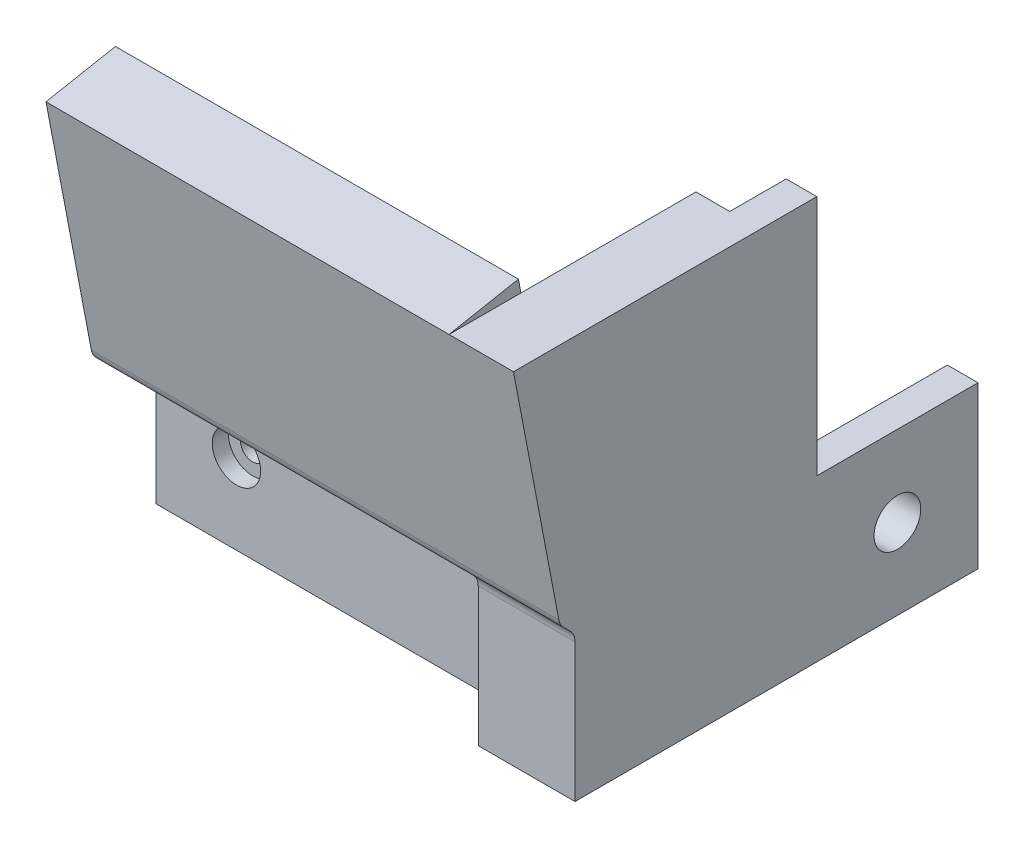
from build123d import *

# Parameters (mm, degrees)
EXTRUDE_1_DEPTH      = 50
SKETCH_2_W           = 50
SKETCH_2_H           = 10
EXTRUDE_2_DEPTH      = 10
SKETCH_3_W           = 10
SKETCH_3_H           = 20
EXTRUDE_3_DEPTH      = 20
SKETCH_4_W           = 20
SKETCH_4_H           = 10
EXTRUDE_4_DEPTH      = 30
CUT_EXTRUDE_1_DEPTH  = 50
CHAMFER_1_SIZE       = 2
SKETCH_9_R           = 1.5
CUT_EXTRUDE_2_DEPTH  = 66.715656955
CUT_EXTRUDE_4_DEPTH  = 6
SKETCH_13_W          = 4
SKETCH_13_H          = 6
EXTRUDE_12_DEPTH     = 18.003980276
FILLET_2_R           = 2
SKETCH_15_W          = 20
SKETCH_15_H          = 50
SKETCH_15_R          = 1.5
EXTRUDE_14_DEPTH     = 4
CUT_EXTRUDE_5_DEPTH  = 4
SKETCH_17_W          = 16
SKETCH_17_H          = 50
CUT_EXTRUDE_6_DEPTH  = 4
EXTRUDE_15_DEPTH     = 10
SKETCH_20_W          = 4
SKETCH_20_H          = 50
EXTRUDE_16_DEPTH     = 20
SKETCH_23_W          = 24
SKETCH_23_H          = 22
CUT_EXTRUDE_9_DEPTH  = 4
EXTRUDE_17_REACH     = 74.184
SKETCH_25_W          = 4
SKETCH_25_H          = 12.288957455
EXTRUDE_18_DEPTH     = 22
CUT_EXTRUDE_10_DEPTH = 4
CUT_EXTRUDE_START    = -4
CUT_EXTRUDE_11_DEPTH = 4
CUT_EXTRUDE_14_DEPTH = 10
EXTRUDE_19_DEPTH     = 4
SKETCH_35_W          = 8
SKETCH_35_H          = 20
EXTRUDE_20_DEPTH     = 22
SKETCH_36_W          = 8
SKETCH_36_H          = 20
EXTRUDE_21_DEPTH     = 20
CUT_EXTRUDE_17_DEPTH = 4.2
SKETCH_38_R          = 1.5
CUT_EXTRUDE_18_DEPTH = 10
SKETCH_39_R          = 2.9
CUT_EXTRUDE_19_DEPTH = 6
SKETCH_40_R          = 3
CUT_EXTRUDE_20_DEPTH = 2
SKETCH_41_W          = 50
SKETCH_41_H          = 16.011247617
EXTRUDE_22_DEPTH     = 1


with BuildPart() as part:
    # 草图1 → 凸台-拉伸1 (new body)
    with BuildSketch(Plane(origin=(0, 0, 0), x_dir=(0, 0, -1), z_dir=(1, 0, 0))):
        Polygon((0, 0), (-10, 0), (-17.629858184, 40), (-10, 41.455368398), (-4, 10), (0, 10), align=None)
    extrude(amount=EXTRUDE_1_DEPTH)

    # 草图2 → 凸台-拉伸2 (add)
    with BuildSketch(Plane.XZ):
        with Locations((25, 5)):
            Rectangle(SKETCH_2_W, SKETCH_2_H)
    extrude(amount=EXTRUDE_2_DEPTH)

    # 草图3 → 凸台-拉伸3 (add)
    with BuildSketch(Plane.ZY):
        with Locations((5, 0)):
            Rectangle(SKETCH_3_W, SKETCH_3_H)
    extrude(amount=EXTRUDE_3_DEPTH)

    # 草图4 → 凸台-拉伸4 (add)
    with BuildSketch(Plane(origin=(0, 10, 0), x_dir=(1, 0, 0), z_dir=(0, 1, 0))):
        with Locations((-10, -5)):
            Rectangle(SKETCH_4_W, SKETCH_4_H)
    extrude(amount=EXTRUDE_4_DEPTH)

    # 草图5 → 切除-拉伸1 (cut)
    with BuildSketch(Plane(origin=(50, 0, 0), x_dir=(0, 0, -1), z_dir=(1, 0, 0))):
        Polygon((-10, 10.003980276), (-11.908223769, 10.003980276), (-10, 0), align=None)
    extrude(amount=-CUT_EXTRUDE_1_DEPTH, mode=Mode.SUBTRACT)

    # 倒角1
    # the kernel refuses this chamfer: 2 mm, written as the material it adds along each edge
    with BuildSketch(Plane(origin=(50, 10.003980276, 10), x_dir=(0, 0.027495876610586487, 0.9996219169112968), z_dir=(-1, 0, 0))) as chamfer_1_piece_1_section:
        Polygon((CHAMFER_1_SIZE * 0.999621916911, -CHAMFER_1_SIZE * 0.0274958766106), (-CHAMFER_1_SIZE * 0.0274958766106, -CHAMFER_1_SIZE * 0.999621916911), (0, 0), align=None)
    chamfer_1_piece_1 = extrude(amount=50, mode=Mode.PRIVATE)
    chamfer_1_piece_1 = split(chamfer_1_piece_1, bisect_by=Plane(origin=(25, 9.131023425, 11.741710345), z_dir=(0, 0.18736828457892524, -0.9822897362458548)), keep=Keep.TOP, mode=Mode.PRIVATE)
    add(chamfer_1_piece_1)

    # 草图9 → 切除-拉伸2 (cut, through all)
    with BuildSketch(Plane.XY.offset(10)):
        with Locations((-10, 20)):
            Circle(SKETCH_9_R)
        with Locations((10, 0)):
            Circle(SKETCH_9_R)
    extrude(amount=-CUT_EXTRUDE_2_DEPTH, mode=Mode.SUBTRACT)

    # 草图12 → 切除-拉伸4 (cut)
    with BuildSketch(Plane.XY.offset(10)):
        Polygon((50, -10), (50, 8.003980276), (0, 8.003980276), (0, 40), (-20, 40), (-20, -10), align=None)
    extrude(amount=-CUT_EXTRUDE_4_DEPTH, mode=Mode.SUBTRACT)

    # 草图13 → 凸台-拉伸12 (add)
    with BuildSketch(Plane.XZ.offset(-8.003980276)):
        with Locations((2, 7)):
            Rectangle(SKETCH_13_W, SKETCH_13_H)
        with Locations((48, 7)):
            Rectangle(SKETCH_13_W, SKETCH_13_H)
    extrude(amount=EXTRUDE_12_DEPTH)

    # 圆角2
    fillet_2_edges = [part.edges().sort_by_distance(p)[0] for p in [
        (2, 8.003980276, 10),
        (48, 8.003980276, 10),
        (25, 9.890571776, 11.8865915),
    ]]
    fillet(fillet_2_edges, radius=FILLET_2_R)

    # 草图15 → 凸台-拉伸14 (add)
    with BuildSketch(Plane(origin=(0, 0, 0), x_dir=(-1, 0, 0), z_dir=(0, 0, -1))):
        with Locations((-60, 15)):
            Rectangle(SKETCH_15_W, SKETCH_15_H)
        with Locations(Location((-60, 20, 0), (0, 0, 180))):
            Circle(SKETCH_15_R, mode=Mode.SUBTRACT)
    extrude(amount=-EXTRUDE_14_DEPTH)

    # 草图16 → 切除-拉伸5 (cut)
    with BuildSketch(Plane.XY.offset(4)):
        Polygon((-20, -10), (0, -10), (0, 10), (0, 40), (-20, 40), align=None)
    extrude(amount=-CUT_EXTRUDE_5_DEPTH, mode=Mode.SUBTRACT)

    # 草图17 → 切除-拉伸6 (cut)
    with BuildSketch(Plane.XY.offset(4)):
        with Locations((62, 15)):
            Rectangle(SKETCH_17_W, SKETCH_17_H)
    extrude(amount=-CUT_EXTRUDE_6_DEPTH, mode=Mode.SUBTRACT)

    # 草图18 → 凸台-拉伸15 (add)
    with BuildSketch(Plane.ZY.offset(-50)):
        Polygon((0, 10), (4, 10), (5.907464546, 20), (0, 20), align=None)
    extrude(amount=EXTRUDE_15_DEPTH)

    # 草图20 → 凸台-拉伸16 (add)
    with BuildSketch(Plane(origin=(0, 0, 0), x_dir=(-1, 0, 0), z_dir=(0, 0, -1))):
        with Locations((-52, 15)):
            Rectangle(SKETCH_20_W, SKETCH_20_H)
    extrude(amount=EXTRUDE_16_DEPTH)

    # 草图23 → 切除-拉伸9 (cut)
    with BuildSketch(Plane(origin=(54, 0, 0), x_dir=(0, 0, -1), z_dir=(1, 0, 0))):
        with Locations((8, 1)):
            Rectangle(SKETCH_23_W, SKETCH_23_H)
    extrude(amount=-CUT_EXTRUDE_9_DEPTH, mode=Mode.SUBTRACT)

    # 凸台-拉伸17: up to this plane
    extrude_17_end = Plane(origin=(50, 0, 10), z_dir=(0, 0.18736828457892524, -0.9822897362458548))
    # 草图24 → 凸台-拉伸17 (add, up to the surface)
    with BuildSketch(Plane.XY.offset(4), mode=Mode.PRIVATE) as extrude_17_sk1:
        Polygon((50, 12), (54, 12), (54, 40), (50, 40), (50, 20), align=None)
    extrude_17_tool1 = split(extrude(extrude_17_sk1.sketch, amount=EXTRUDE_17_REACH, mode=Mode.PRIVATE), bisect_by=extrude_17_end, keep=Keep.BOTH, mode=Mode.PRIVATE)
    add(extrude_17_tool1.solids().sort_by_distance((52, 26, 4))[0])

    # 草图25 → 凸台-拉伸18 (add)
    with BuildSketch(Plane.XZ.offset(-12)):
        with Locations((52, 6.144478728)):
            Rectangle(SKETCH_25_W, SKETCH_25_H)
    extrude(amount=EXTRUDE_18_DEPTH)

    # 草图26 → 切除-拉伸10 (cut)
    with BuildSketch(Plane.ZY.offset(-50)):
        with BuildLine():
            Line((12.288957455, -10), (12.288957455, 12))
            Line((12.288957455, 12), (12.001878243, 10.494969601))
            ThreePointArc((12.001878243, 10.494969601), (11.804836237, 9.933858265), (11.451512332, 9.455492608))
            Line((11.451512332, 9.455492608), (10.585786438, 8.589766713))
            ThreePointArc((10.585786438, 8.589766713), (10.152240935, 7.940920016), (10, 7.175553151))
            Line((10, 7.175553151), (10, -10))
            Line((10, -10), (12.288957455, -10))
        make_face()
    extrude(amount=-CUT_EXTRUDE_10_DEPTH, mode=Mode.SUBTRACT)

    # 草图27 → 切除-拉伸11 (cut)
    with BuildSketch(Plane(origin=(4, 0, 0), x_dir=(0, 0, -1), z_dir=(1, 0, 0)).offset(CUT_EXTRUDE_START)):
        with BuildLine():
            Line((-10, -10), (-4, -10))
            Line((-4, -10), (-4, 8.003980276))
            Line((-4, 8.003980276), (-10, 8.003980276))
            Line((-10, 8.003980276), (-10.585786438, 8.589766713))
            ThreePointArc((-10.585786438, 8.589766713), (-10.152240935, 7.940920016), (-10, 7.175553151))
            Line((-10, 7.175553151), (-10, -10))
        make_face()
    extrude(amount=CUT_EXTRUDE_11_DEPTH, mode=Mode.SUBTRACT)

    # 草图31 → 切除-拉伸14 (cut)
    with BuildSketch(Plane.ZY.offset(-40)):
        Polygon((0, 20), (0, 10), (4, 10), (5.907464546, 20), align=None)
    extrude(amount=-CUT_EXTRUDE_14_DEPTH, mode=Mode.SUBTRACT)

    # 草图32 → 凸台-拉伸19 (add)
    with BuildSketch(Plane(origin=(54, 0, 0), x_dir=(0, 0, -1), z_dir=(1, 0, 0))):
        with BuildLine():
            Line((-10, 7.175553151), (-10, -10))
            Line((-10, -10), (0, -10))
            Line((0, -10), (0, 12))
            Line((0, 12), (20, 12))
            Line((20, 12), (20, 40))
            Line((20, 40), (-17.629858184, 40))
            Line((-17.629858184, 40), (-12.001878243, 10.494969601))
            ThreePointArc((-12.001878243, 10.494969601), (-11.804836237, 9.933858265), (-11.451512332, 9.455492608))
            Line((-11.451512332, 9.455492608), (-10.585786438, 8.589766713))
            ThreePointArc((-10.585786438, 8.589766713), (-10.152240935, 7.940920016), (-10, 7.175553151))
        make_face()
    extrude(amount=EXTRUDE_19_DEPTH)

    # 草图35 → 凸台-拉伸20 (add)
    with BuildSketch(Plane.XZ.offset(-12)):
        with Locations((54, -10)):
            Rectangle(SKETCH_35_W, SKETCH_35_H)
    extrude(amount=EXTRUDE_20_DEPTH)

    # 草图36 → 凸台-拉伸21 (add)
    with BuildSketch(Plane(origin=(0, 0, -20), x_dir=(-1, 0, 0), z_dir=(0, 0, -1))):
        with Locations((-54, 0)):
            Rectangle(SKETCH_36_W, SKETCH_36_H)
    extrude(amount=EXTRUDE_21_DEPTH)

    # 草图37 → 切除-拉伸17 (cut)
    with BuildSketch(Plane.ZY.offset(-50)):
        Polygon((-20, 40), (-13, 40), (-13, 3), (-40, 3), (-40, 10), (-20, 10), align=None)
    extrude(amount=-CUT_EXTRUDE_17_DEPTH, mode=Mode.SUBTRACT)

    # 草图38 → 切除-拉伸18 (cut)
    with BuildSketch(Plane(origin=(58, 0, 0), x_dir=(0, 0, -1), z_dir=(1, 0, 0))):
        with Locations(Location((30, 0, 0), (0, 0, 90))):
            Circle(SKETCH_38_R)
    extrude(amount=-CUT_EXTRUDE_18_DEPTH, mode=Mode.SUBTRACT)

    # 草图39 → 切除-拉伸19 (cut)
    with BuildSketch(Plane(origin=(58, 0, 0), x_dir=(0, 0, -1), z_dir=(1, 0, 0))):
        with Locations(Location((30, 0, 0), (0, 0, 90))):
            Circle(SKETCH_39_R)
    extrude(amount=-CUT_EXTRUDE_19_DEPTH, mode=Mode.SUBTRACT)

    # 草图40 → 切除-拉伸20 (cut)
    with BuildSketch(Plane.XY.offset(4)):
        with Locations((10, 0)):
            Circle(SKETCH_40_R)
    extrude(amount=-CUT_EXTRUDE_20_DEPTH, mode=Mode.SUBTRACT)

    # 草图41 → 凸台-拉伸22 (add)
    with BuildSketch(Plane(origin=(0, -0.385131031, 2.019073075), x_dir=(-1, 0, 0), z_dir=(0, 0.18736828457892515, -0.9822897362458548))):
        with Locations((-25, 34.589241927)):
            Rectangle(SKETCH_41_W, SKETCH_41_H)
    extrude(amount=EXTRUDE_22_DEPTH)


solid = part.part
